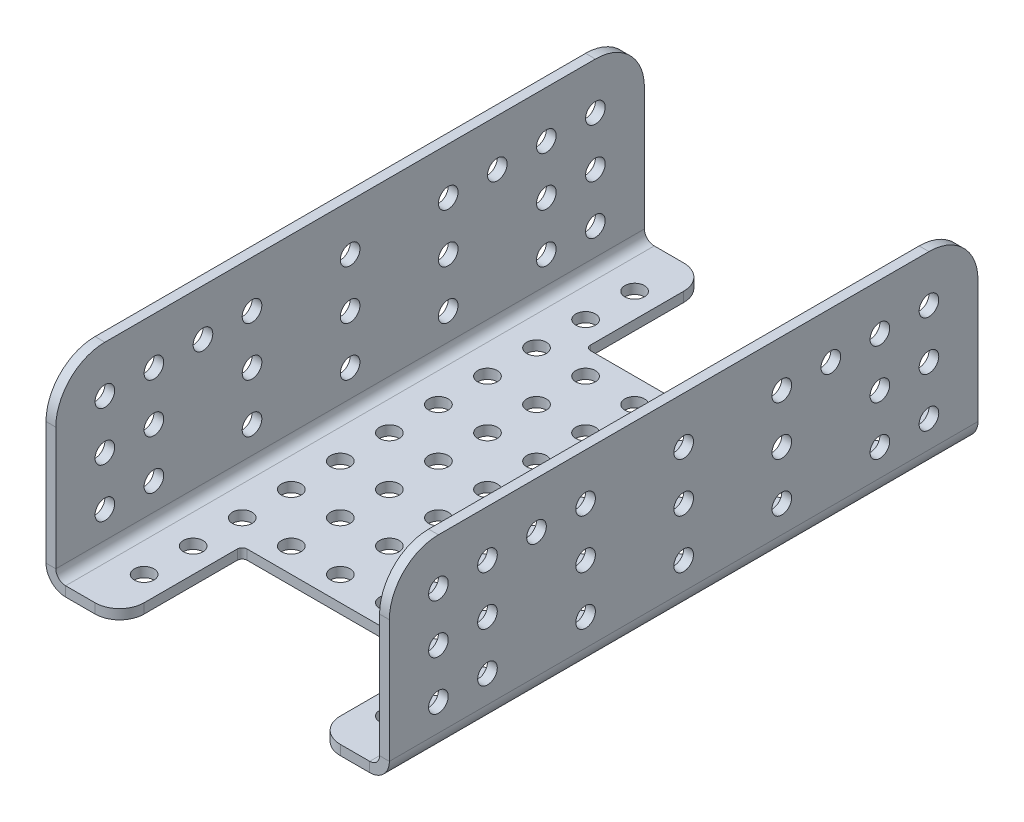
from build123d import *

# Parameters (mm, degrees)
SKETCH1_W                      = 66
SKETCH1_H                      = 120
BOSS_EXTRUDE1_DEPTH            = 2
SKETCH2_R                      = 2
CUT_EXTRUDE1_DEPTH             = 137.967149346
EDGE_FLANGE1_STRIP_W           = 12
EDGE_FLANGE1_STRIP_H           = 2
EDGE_FLANGE1_STRIP_CUT_DEPTH   = 120
EDGE_FLANGE1_STRIP_2_W         = 12
EDGE_FLANGE1_STRIP_2_H         = 2
EDGE_FLANGE1_STRIP_CUT_2_DEPTH = 120
EDGE_FLANGE1_DEPTH             = 120
EDGE_FLANGE1_BEND_DEPTH        = 120
SKETCH24_W                     = 40
SKETCH24_H                     = 25
CUT_EXTRUDE6_DEPTH             = 143.804061567
FILLET1_R                      = 10
FILLET2_R                      = 5
FILLET3_R                      = 1
SKETCH25_R                     = 2
CUT_EXTRUDE8_DEPTH             = 145.294837052


# Sheet-metal steps are written as plain solids
with BuildPart() as part:
    # Sketch1 → Boss-Extrude1 (new body)
    with BuildSketch(Plane(origin=(0, 0, 0), x_dir=(1, 0, 0), z_dir=(0, 1, 0))):
        with Locations((33, 60)):
            Rectangle(SKETCH1_W, SKETCH1_H)
    extrude(amount=BOSS_EXTRUDE1_DEPTH)

    # Sketch2 → Cut-Extrude1 (cut, through all)
    with BuildSketch(Plane(origin=(0, 2, 0), x_dir=(1, 0, 0), z_dir=(0, 1, 0))):
        with Locations(Location((8, 110, 0), (0, 0, 270))):
            Circle(SKETCH2_R)
        with Locations(Location((18, 110, 0), (0, 0, 270))):
            Circle(SKETCH2_R)
        with Locations(Location((28, 110, 0), (0, 0, 270))):
            Circle(SKETCH2_R)
        with Locations(Location((38, 110, 0), (0, 0, 270))):
            Circle(SKETCH2_R)
        with Locations(Location((48, 110, 0), (0, 0, 270))):
            Circle(SKETCH2_R)
        with Locations(Location((58, 110, 0), (0, 0, 270))):
            Circle(SKETCH2_R)
        with Locations(Location((18, 100, 0), (0, 0, 270))):
            Circle(SKETCH2_R)
        with Locations(Location((28, 100, 0), (0, 0, 270))):
            Circle(SKETCH2_R)
        with Locations(Location((38, 100, 0), (0, 0, 270))):
            Circle(SKETCH2_R)
        with Locations(Location((48, 100, 0), (0, 0, 270))):
            Circle(SKETCH2_R)
        with Locations(Location((58, 100, 0), (0, 0, 270))):
            Circle(SKETCH2_R)
        with Locations(Location((18, 90, 0), (0, 0, 270))):
            Circle(SKETCH2_R)
        with Locations(Location((28, 90, 0), (0, 0, 270))):
            Circle(SKETCH2_R)
        with Locations(Location((38, 90, 0), (0, 0, 270))):
            Circle(SKETCH2_R)
        with Locations(Location((48, 90, 0), (0, 0, 270))):
            Circle(SKETCH2_R)
        with Locations(Location((58, 90, 0), (0, 0, 270))):
            Circle(SKETCH2_R)
        with Locations(Location((18, 80, 0), (0, 0, 270))):
            Circle(SKETCH2_R)
        with Locations(Location((28, 80, 0), (0, 0, 270))):
            Circle(SKETCH2_R)
        with Locations(Location((38, 80, 0), (0, 0, 270))):
            Circle(SKETCH2_R)
        with Locations(Location((48, 80, 0), (0, 0, 270))):
            Circle(SKETCH2_R)
        with Locations(Location((58, 80, 0), (0, 0, 270))):
            Circle(SKETCH2_R)
        with Locations(Location((18, 70, 0), (0, 0, 270))):
            Circle(SKETCH2_R)
        with Locations(Location((28, 70, 0), (0, 0, 270))):
            Circle(SKETCH2_R)
        with Locations(Location((38, 70, 0), (0, 0, 270))):
            Circle(SKETCH2_R)
        with Locations(Location((48, 70, 0), (0, 0, 270))):
            Circle(SKETCH2_R)
        with Locations(Location((58, 70, 0), (0, 0, 270))):
            Circle(SKETCH2_R)
        with Locations(Location((18, 60, 0), (0, 0, 270))):
            Circle(SKETCH2_R)
        with Locations(Location((28, 60, 0), (0, 0, 270))):
            Circle(SKETCH2_R)
        with Locations(Location((38, 60, 0), (0, 0, 270))):
            Circle(SKETCH2_R)
        with Locations(Location((48, 60, 0), (0, 0, 270))):
            Circle(SKETCH2_R)
        with Locations(Location((58, 60, 0), (0, 0, 270))):
            Circle(SKETCH2_R)
        with Locations(Location((18, 50, 0), (0, 0, 270))):
            Circle(SKETCH2_R)
        with Locations(Location((28, 50, 0), (0, 0, 270))):
            Circle(SKETCH2_R)
        with Locations(Location((38, 50, 0), (0, 0, 270))):
            Circle(SKETCH2_R)
        with Locations(Location((48, 50, 0), (0, 0, 270))):
            Circle(SKETCH2_R)
        with Locations(Location((58, 50, 0), (0, 0, 270))):
            Circle(SKETCH2_R)
        with Locations(Location((18, 40, 0), (0, 0, 270))):
            Circle(SKETCH2_R)
        with Locations(Location((28, 40, 0), (0, 0, 270))):
            Circle(SKETCH2_R)
        with Locations(Location((38, 40, 0), (0, 0, 270))):
            Circle(SKETCH2_R)
        with Locations(Location((48, 40, 0), (0, 0, 270))):
            Circle(SKETCH2_R)
        with Locations(Location((58, 40, 0), (0, 0, 270))):
            Circle(SKETCH2_R)
        with Locations(Location((18, 30, 0), (0, 0, 270))):
            Circle(SKETCH2_R)
        with Locations(Location((28, 30, 0), (0, 0, 270))):
            Circle(SKETCH2_R)
        with Locations(Location((38, 30, 0), (0, 0, 270))):
            Circle(SKETCH2_R)
        with Locations(Location((48, 30, 0), (0, 0, 270))):
            Circle(SKETCH2_R)
        with Locations(Location((58, 30, 0), (0, 0, 270))):
            Circle(SKETCH2_R)
        with Locations(Location((18, 20, 0), (0, 0, 270))):
            Circle(SKETCH2_R)
        with Locations(Location((28, 20, 0), (0, 0, 270))):
            Circle(SKETCH2_R)
        with Locations(Location((38, 20, 0), (0, 0, 270))):
            Circle(SKETCH2_R)
        with Locations(Location((48, 20, 0), (0, 0, 270))):
            Circle(SKETCH2_R)
        with Locations(Location((58, 20, 0), (0, 0, 270))):
            Circle(SKETCH2_R)
        with Locations(Location((18, 10, 0), (0, 0, 270))):
            Circle(SKETCH2_R)
        with Locations(Location((28, 10, 0), (0, 0, 270))):
            Circle(SKETCH2_R)
        with Locations(Location((38, 10, 0), (0, 0, 270))):
            Circle(SKETCH2_R)
        with Locations(Location((48, 10, 0), (0, 0, 270))):
            Circle(SKETCH2_R)
        with Locations(Location((58, 10, 0), (0, 0, 270))):
            Circle(SKETCH2_R)
        with Locations(Location((8, 100, 0), (0, 0, 270))):
            Circle(SKETCH2_R)
        with Locations(Location((8, 90, 0), (0, 0, 270))):
            Circle(SKETCH2_R)
        with Locations(Location((8, 80, 0), (0, 0, 270))):
            Circle(SKETCH2_R)
        with Locations(Location((8, 70, 0), (0, 0, 270))):
            Circle(SKETCH2_R)
        with Locations(Location((8, 60, 0), (0, 0, 270))):
            Circle(SKETCH2_R)
        with Locations(Location((8, 50, 0), (0, 0, 270))):
            Circle(SKETCH2_R)
        with Locations(Location((8, 40, 0), (0, 0, 270))):
            Circle(SKETCH2_R)
        with Locations(Location((8, 30, 0), (0, 0, 270))):
            Circle(SKETCH2_R)
        with Locations(Location((8, 20, 0), (0, 0, 270))):
            Circle(SKETCH2_R)
        with Locations(Location((8, 10, 0), (0, 0, 270))):
            Circle(SKETCH2_R)
    extrude(amount=-CUT_EXTRUDE1_DEPTH, mode=Mode.SUBTRACT)

    # Edge-Flange1 strip (across the edge) → Edge-Flange1 strip cut (cut)
    with BuildSketch(Plane(origin=(0, 2, -120), x_dir=(1, 0, 0), z_dir=(0, 0, 1))):
        with Locations((-4, -1)):
            Rectangle(EDGE_FLANGE1_STRIP_W, EDGE_FLANGE1_STRIP_H)
    extrude(amount=EDGE_FLANGE1_STRIP_CUT_DEPTH, mode=Mode.SUBTRACT)

    # Edge-Flange1 strip 2 (across the edge) → Edge-Flange1 strip cut 2 (cut)
    with BuildSketch(Plane(origin=(66, 2, 0), x_dir=(-1, 0, 0), z_dir=(0, 0, -1))):
        with Locations((-4, -1)):
            Rectangle(EDGE_FLANGE1_STRIP_2_W, EDGE_FLANGE1_STRIP_2_H)
    extrude(amount=EDGE_FLANGE1_STRIP_CUT_2_DEPTH, mode=Mode.SUBTRACT)

    # Edge-Flange1 section (across the edge) → Edge-Flange1 (add)
    with BuildSketch(Plane(origin=(0, 2, -120), x_dir=(1, 0, 0), z_dir=(0, 0, 1))):
        with BuildLine():
            Line((-2, 2), (-2, 37))
            Line((-2, 37), (0, 37))
            Line((0, 37), (0, 2))
            ThreePointArc((0, 2), (0.585786438, 0.585786438), (2, 0))
            Line((2, 0), (2, -2))
            ThreePointArc((2, -2), (-0.828427125, -0.828427125), (-2, 2))
        make_face()
    extrude(amount=EDGE_FLANGE1_DEPTH)

    # Edge-Flange1 section 2 (across the edge) → Edge-Flange1 bend (add)
    with BuildSketch(Plane(origin=(66, 2, 0), x_dir=(-1, 0, 0), z_dir=(0, 0, -1))):
        with BuildLine():
            Line((-2, 2), (-2, 37))
            Line((-2, 37), (0, 37))
            Line((0, 37), (0, 2))
            ThreePointArc((0, 2), (0.585786438, 0.585786438), (2, 0))
            Line((2, 0), (2, -2))
            ThreePointArc((2, -2), (-0.828427125, -0.828427125), (-2, 2))
        make_face()
    extrude(amount=EDGE_FLANGE1_BEND_DEPTH)

    # Sketch24 → Cut-Extrude6 (cut, through all)
    with BuildSketch(Plane(origin=(0, 2, 0), x_dir=(1, 0, 0), z_dir=(0, 1, 0))):
        with Locations((33, 107.5)):
            Rectangle(SKETCH24_W, SKETCH24_H)
        with Locations((33, 12.5)):
            Rectangle(SKETCH24_W, SKETCH24_H)
    extrude(amount=-CUT_EXTRUDE6_DEPTH, mode=Mode.SUBTRACT)

    # Fillet1
    fillet1_edges = [part.edges().sort_by_distance(p)[0] for p in [
        (-1, 39, -120),
        (-1, 39, 0),
        (67, 39, 0),
        (67, 39, -120),
    ]]
    fillet(fillet1_edges, radius=FILLET1_R)

    # Fillet2
    fillet2_edges = [part.edges().sort_by_distance(p)[0] for p in [
        (13, 1, -120),
        (53, 1, -120),
        (53, 1, 0),
        (13, 1, 0),
    ]]
    fillet(fillet2_edges, radius=FILLET2_R)

    # Fillet3
    fillet3_edges = [part.edges().sort_by_distance(p)[0] for p in [
        (13, 1, -95),
        (53, 1, -95),
        (13, 1, -25),
        (53, 1, -25),
    ]]
    fillet(fillet3_edges, radius=FILLET3_R)

    # Sketch25 → Cut-Extrude8 (cut, through all)
    with BuildSketch(Plane(origin=(68, 0, 0), x_dir=(0, 0, -1), z_dir=(1, 0, 0))):
        with Locations(Location((10, 29.5, 0), (0, 0, 90))):
            Circle(SKETCH25_R)
        with Locations(Location((20, 29.5, 0), (0, 0, 90))):
            Circle(SKETCH25_R)
        with Locations(Location((30, 29.5, 0), (0, 0, 90))):
            Circle(SKETCH25_R)
        with Locations(Location((40, 29.5, 0), (0, 0, 90))):
            Circle(SKETCH25_R)
        with Locations(Location((60, 29.5, 0), (0, 0, 90))):
            Circle(SKETCH25_R)
        with Locations(Location((80, 29.5, 0), (0, 0, 90))):
            Circle(SKETCH25_R)
        with Locations(Location((90, 29.5, 0), (0, 0, 90))):
            Circle(SKETCH25_R)
        with Locations(Location((100, 29.5, 0), (0, 0, 90))):
            Circle(SKETCH25_R)
        with Locations(Location((110, 29.5, 0), (0, 0, 90))):
            Circle(SKETCH25_R)
        with Locations(Location((20, 19.5, 0), (0, 0, 90))):
            Circle(SKETCH25_R)
        with Locations(Location((40, 19.5, 0), (0, 0, 90))):
            Circle(SKETCH25_R)
        with Locations(Location((60, 19.5, 0), (0, 0, 90))):
            Circle(SKETCH25_R)
        with Locations(Location((80, 19.5, 0), (0, 0, 90))):
            Circle(SKETCH25_R)
        with Locations(Location((100, 19.5, 0), (0, 0, 90))):
            Circle(SKETCH25_R)
        with Locations(Location((110, 19.5, 0), (0, 0, 90))):
            Circle(SKETCH25_R)
        with Locations(Location((20, 9.5, 0), (0, 0, 90))):
            Circle(SKETCH25_R)
        with Locations(Location((40, 9.5, 0), (0, 0, 90))):
            Circle(SKETCH25_R)
        with Locations(Location((60, 9.5, 0), (0, 0, 90))):
            Circle(SKETCH25_R)
        with Locations(Location((80, 9.5, 0), (0, 0, 90))):
            Circle(SKETCH25_R)
        with Locations(Location((100, 9.5, 0), (0, 0, 90))):
            Circle(SKETCH25_R)
        with Locations(Location((110, 9.5, 0), (0, 0, 90))):
            Circle(SKETCH25_R)
        with Locations(Location((10, 19.5, 0), (0, 0, 90))):
            Circle(SKETCH25_R)
        with Locations(Location((10, 9.5, 0), (0, 0, 90))):
            Circle(SKETCH25_R)
    extrude(amount=-CUT_EXTRUDE8_DEPTH, mode=Mode.SUBTRACT)


solid = part.part
